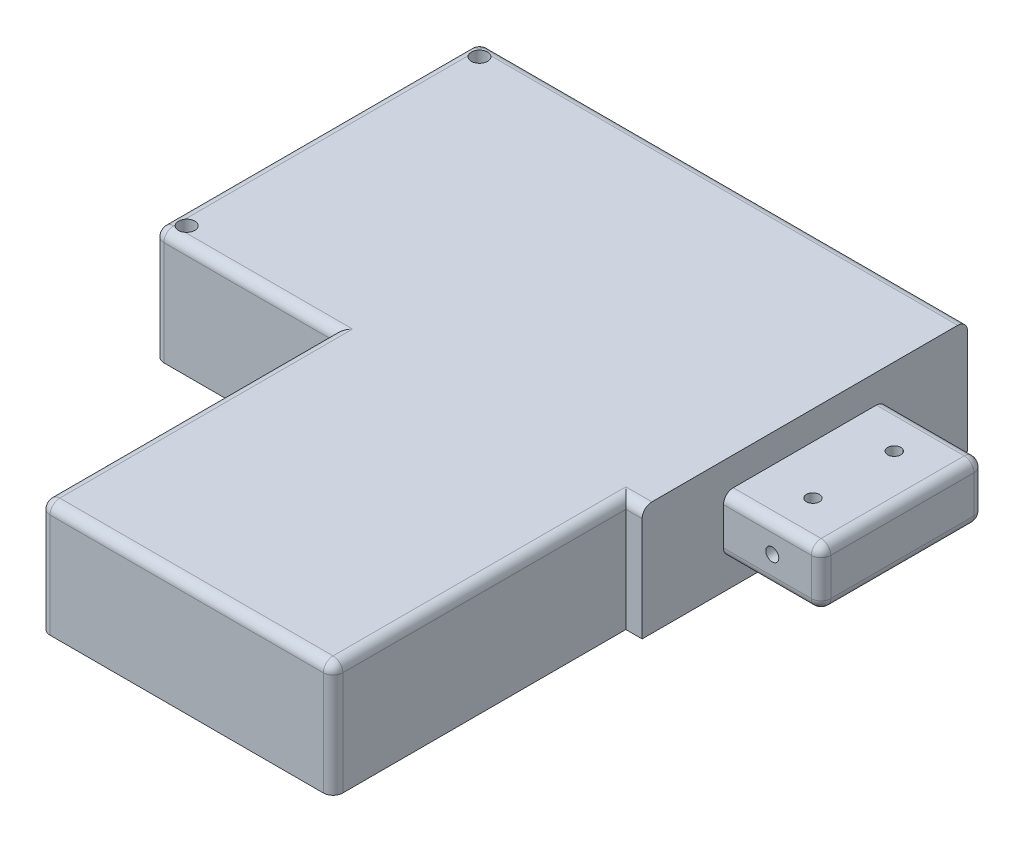
from build123d import *

# Parameters (mm, degrees)
SKETCH1_W           = 150
SKETCH1_H           = 100
BOSS_EXTRUDE1_DEPTH = 35
SKETCH2_R           = 2.5
CUT_EXTRUDE1_DEPTH  = 97.695398029
SKETCH3_W           = 90
SKETCH3_H           = 90
BOSS_EXTRUDE2_DEPTH = 35
CUT_EXTRUDE2_START  = -35
SKETCH4_R           = 18.5
CUT_EXTRUDE2_DEPTH  = 7
CUT_EXTRUDE3_START  = -35
SKETCH5_R           = 14
CUT_EXTRUDE3_DEPTH  = 25
SKETCH6_W           = 50
SKETCH6_H           = 17.5
BOSS_EXTRUDE3_DEPTH = 30
SKETCH7_R           = 2
CUT_EXTRUDE4_DEPTH  = 8
SKETCH8_R           = 2
CUT_EXTRUDE5_DEPTH  = 8
FILLET1_R           = 3


with BuildPart() as part:
    # Sketch1 → Boss-Extrude1 (new body)
    with BuildSketch(Plane(origin=(0, 0, 0), x_dir=(1, 0, 0), z_dir=(0, 1, 0))):
        Rectangle(SKETCH1_W, SKETCH1_H)
    extrude(amount=BOSS_EXTRUDE1_DEPTH)

    # Sketch2 → Cut-Extrude1 (cut, through all)
    with BuildSketch(Plane(origin=(0, 35, 0), x_dir=(1, 0, 0), z_dir=(0, 1, 0))):
        with Locations(Location((-70, 45, 0), (0, 0, 270))):
            Circle(SKETCH2_R)
        with Locations(Location((-70, -45, 0), (0, 0, 90))):
            Circle(SKETCH2_R)
    extrude(amount=-CUT_EXTRUDE1_DEPTH, mode=Mode.SUBTRACT)

    # Sketch3 → Boss-Extrude2 (add)
    with BuildSketch(Plane(origin=(0, 35, 0), x_dir=(1, 0, 0), z_dir=(0, 1, 0))):
        with Locations((25, -95)):
            Rectangle(SKETCH3_W, SKETCH3_H)
    extrude(amount=-BOSS_EXTRUDE2_DEPTH)

    # Sketch4 → Cut-Extrude2 (cut)
    with BuildSketch(Plane(origin=(0, 35, 0), x_dir=(1, 0, 0), z_dir=(0, 1, 0)).offset(CUT_EXTRUDE2_START)):
        with Locations(Location((25, -115, 0), (0, 0, 270))):
            Circle(SKETCH4_R)
        with Locations(Location((25, 0, 0), (0, 0, 270))):
            Circle(SKETCH4_R)
    extrude(amount=CUT_EXTRUDE2_DEPTH, mode=Mode.SUBTRACT)

    # Sketch5 → Cut-Extrude3 (cut)
    with BuildSketch(Plane(origin=(0, 35, 0), x_dir=(1, 0, 0), z_dir=(0, 1, 0)).offset(CUT_EXTRUDE3_START)):
        with Locations(Location((25, -115, 0), (0, 0, 270))):
            Circle(SKETCH5_R)
        with Locations(Location((25, 0, 0), (0, 0, 270))):
            Circle(SKETCH5_R)
    extrude(amount=CUT_EXTRUDE3_DEPTH, mode=Mode.SUBTRACT)

    # Sketch6 → Boss-Extrude3 (add)
    with BuildSketch(Plane(origin=(75, 0, 0), x_dir=(0, 0, -1), z_dir=(1, 0, 0))):
        with Locations((0, 17.5)):
            Rectangle(SKETCH6_W, SKETCH6_H)
    extrude(amount=BOSS_EXTRUDE3_DEPTH)

    # Sketch7 → Cut-Extrude4 (cut)
    with BuildSketch(Plane(origin=(0, 26.25, 0), x_dir=(1, 0, 0), z_dir=(0, 1, 0))):
        with Locations(Location((90, 12.5, 0), (0, 0, 270))):
            Circle(SKETCH7_R)
        with Locations(Location((90, -12.5, 0), (0, 0, 90))):
            Circle(SKETCH7_R)
    extrude(amount=-CUT_EXTRUDE4_DEPTH, mode=Mode.SUBTRACT)

    # Sketch8 → Cut-Extrude5 (cut)
    with BuildSketch(Plane(origin=(0, 0, -25), x_dir=(-1, 0, 0), z_dir=(0, 0, -1))):
        with Locations(Location((-90, 17.5, 0), (0, 0, 90))):
            Circle(SKETCH8_R)
    cut_extrude5 = extrude(amount=-CUT_EXTRUDE5_DEPTH, mode=Mode.SUBTRACT)

    # Mirror1: Cut-Extrude5 across plane
    add(cut_extrude5.mirror(Plane.XY), mode=Mode.SUBTRACT)

    # Fillet1
    # the kernel refuses this fillet: 3 mm, written as the material it takes off along each edge
    with BuildSketch(Plane(origin=(-72, 32, 47), x_dir=(0, 1, 0), z_dir=(-1, 0, 0))) as fillet1_piece_1_section:
        Polygon((0, 0), (FILLET1_R, 0), (FILLET1_R, -FILLET1_R), (0, -FILLET1_R), align=None)
    fillet1_piece_1 = extrude(amount=FILLET1_R, mode=Mode.PRIVATE)
    fillet1_piece_1 = fillet1_piece_1 - Plane(origin=(-72, 32, 47), x_dir=(0, -0.7071067811865475, -0.7071067811865475), z_dir=(-1, 0, 0)) * Sphere(FILLET1_R, mode=Mode.PRIVATE)
    add(fillet1_piece_1, mode=Mode.SUBTRACT)
    with BuildSketch(Plane(origin=(-72, 32, -47), x_dir=(-1, 0, 0), z_dir=(0, 0, -1))) as fillet1_piece_2_section:
        Polygon((0, 0), (FILLET1_R, 0), (FILLET1_R, FILLET1_R), (0, FILLET1_R), align=None)
    fillet1_piece_2 = extrude(amount=FILLET1_R, mode=Mode.PRIVATE)
    fillet1_piece_2 = fillet1_piece_2 - Plane(origin=(-72, 32, -47), x_dir=(0.7071067811865475, -0.7071067811865475, 0), z_dir=(0, 0, -1)) * Sphere(FILLET1_R, mode=Mode.PRIVATE)
    add(fillet1_piece_2, mode=Mode.SUBTRACT)
    with BuildSketch(Plane(origin=(67, 32, 137), x_dir=(1, 0, 0), z_dir=(0, 1, 0))) as fillet1_piece_3_section:
        Polygon((0, 0), (FILLET1_R, 0), (FILLET1_R, -FILLET1_R), (0, -FILLET1_R), align=None)
    fillet1_piece_3 = extrude(amount=FILLET1_R, mode=Mode.PRIVATE)
    fillet1_piece_3 = fillet1_piece_3 - Plane(origin=(67, 32, 137), x_dir=(-0.7071067811865475, 0, -0.7071067811865475), z_dir=(0, 1, 0)) * Sphere(FILLET1_R, mode=Mode.PRIVATE)
    add(fillet1_piece_3, mode=Mode.SUBTRACT)
    with BuildSketch(Plane(origin=(-17, 32, 137), x_dir=(0, 1, 0), z_dir=(-1, 0, 0))) as fillet1_piece_4_section:
        Polygon((0, 0), (FILLET1_R, 0), (FILLET1_R, -FILLET1_R), (0, -FILLET1_R), align=None)
    fillet1_piece_4 = extrude(amount=FILLET1_R, mode=Mode.PRIVATE)
    fillet1_piece_4 = fillet1_piece_4 - Plane(origin=(-17, 32, 137), x_dir=(0, -0.7071067811865475, -0.7071067811865475), z_dir=(-1, 0, 0)) * Sphere(FILLET1_R, mode=Mode.PRIVATE)
    add(fillet1_piece_4, mode=Mode.SUBTRACT)
    with BuildSketch(Plane(origin=(102, 11.75, -22), x_dir=(0, 0, -1), z_dir=(0, -1, 0))) as fillet1_piece_5_section:
        Polygon((0, 0), (FILLET1_R, 0), (FILLET1_R, FILLET1_R), (0, FILLET1_R), align=None)
    fillet1_piece_5 = extrude(amount=FILLET1_R, mode=Mode.PRIVATE)
    fillet1_piece_5 = fillet1_piece_5 - Plane(origin=(102, 11.75, -22), x_dir=(-0.7071067811865475, 0, 0.7071067811865475), z_dir=(0, -1, 0)) * Sphere(FILLET1_R, mode=Mode.PRIVATE)
    add(fillet1_piece_5, mode=Mode.SUBTRACT)
    with BuildSketch(Plane(origin=(102, 23.25, -22), x_dir=(0, 1, 0), z_dir=(0, 0, -1))) as fillet1_piece_6_section:
        Polygon((0, 0), (FILLET1_R, 0), (FILLET1_R, FILLET1_R), (0, FILLET1_R), align=None)
    fillet1_piece_6 = extrude(amount=FILLET1_R, mode=Mode.PRIVATE)
    fillet1_piece_6 = fillet1_piece_6 - Plane(origin=(102, 23.25, -22), x_dir=(-0.7071067811865475, -0.7071067811865475, 0), z_dir=(0, 0, -1)) * Sphere(FILLET1_R, mode=Mode.PRIVATE)
    add(fillet1_piece_6, mode=Mode.SUBTRACT)
    with BuildSketch(Plane(origin=(102, 23.25, 22), x_dir=(1, 0, 0), z_dir=(0, 1, 0))) as fillet1_piece_7_section:
        Polygon((0, 0), (FILLET1_R, 0), (FILLET1_R, -FILLET1_R), (0, -FILLET1_R), align=None)
    fillet1_piece_7 = extrude(amount=FILLET1_R, mode=Mode.PRIVATE)
    fillet1_piece_7 = fillet1_piece_7 - Plane(origin=(102, 23.25, 22), x_dir=(-0.7071067811865475, 0, -0.7071067811865475), z_dir=(0, 1, 0)) * Sphere(FILLET1_R, mode=Mode.PRIVATE)
    add(fillet1_piece_7, mode=Mode.SUBTRACT)
    with BuildSketch(Plane(origin=(102, 11.75, 22), x_dir=(1, 0, 0), z_dir=(0, -1, 0))) as fillet1_piece_8_section:
        Polygon((0, 0), (FILLET1_R, 0), (FILLET1_R, FILLET1_R), (0, FILLET1_R), align=None)
    fillet1_piece_8 = extrude(amount=FILLET1_R, mode=Mode.PRIVATE)
    fillet1_piece_8 = fillet1_piece_8 - Plane(origin=(102, 11.75, 22), x_dir=(-0.7071067811865475, 0, -0.7071067811865475), z_dir=(0, -1, 0)) * Sphere(FILLET1_R, mode=Mode.PRIVATE)
    add(fillet1_piece_8, mode=Mode.SUBTRACT)
    with BuildSketch(Plane(origin=(-75, 35, 47), x_dir=(0, -1, 0), z_dir=(0, 0, -1))) as fillet1_piece_9:
        with BuildLine():
            CenterArc((FILLET1_R, -FILLET1_R), FILLET1_R, 90, 90)
            Line((0, -FILLET1_R), (0, 0))
            Line((0, 0), (FILLET1_R, 0))
        make_face()
    extrude(amount=94, mode=Mode.SUBTRACT)
    with BuildSketch(Plane(origin=(-20, 35, 50), x_dir=(0, 0, -1), z_dir=(-1, 0, 0))) as fillet1_piece_10:
        with BuildLine():
            CenterArc((FILLET1_R, FILLET1_R), FILLET1_R, 180, 90)
            Line((0, FILLET1_R), (0, 0))
            Line((0, 0), (FILLET1_R, 0))
        make_face()
    extrude(amount=52, mode=Mode.SUBTRACT)
    with BuildSketch(Plane(origin=(82.5, 35, 50), x_dir=(0, 0, -1), z_dir=(-1, 0, 0))) as fillet1_piece_11:
        with BuildLine():
            CenterArc((FILLET1_R, FILLET1_R), FILLET1_R, 180, 90)
            Line((0, FILLET1_R), (0, 0))
            Line((0, 0), (FILLET1_R, 0))
        make_face()
    extrude(amount=12.5, mode=Mode.SUBTRACT)
    with BuildSketch(Plane(origin=(70, 32, 140), x_dir=(0, 0, -1), z_dir=(0, -1, 0)), Plane(origin=(-75, -7.5, 50), x_dir=(0, 0, -1), z_dir=(0, 1, 0)), Plane(origin=(-75, -7.5, -50), x_dir=(1, 0, 0), z_dir=(0, 1, 0))) as fillet1_piece_12:
        with BuildLine():
            CenterArc((FILLET1_R, -FILLET1_R), FILLET1_R, 90, 90)
            Line((0, -FILLET1_R), (0, 0))
            Line((0, 0), (FILLET1_R, 0))
        make_face()
    extrude(amount=39.5, mode=Mode.SUBTRACT)
    with BuildSketch(Plane(origin=(-20, 32, 140), x_dir=(0, 0, -1), z_dir=(0, -1, 0))) as fillet1_piece_13:
        with BuildLine():
            CenterArc((FILLET1_R, FILLET1_R), FILLET1_R, 180, 90)
            Line((0, FILLET1_R), (0, 0))
            Line((0, 0), (FILLET1_R, 0))
        make_face()
    extrude(amount=39.5, mode=Mode.SUBTRACT)
    with BuildSketch(Plane(origin=(70, 35, 137), x_dir=(-1, 0, 0), z_dir=(0, 0, -1)), Plane(origin=(-20, 35, 50), x_dir=(1, 0, 0), z_dir=(0, 0, 1))) as fillet1_piece_14:
        with BuildLine():
            CenterArc((FILLET1_R, -FILLET1_R), FILLET1_R, 90, 90)
            Line((0, -FILLET1_R), (0, 0))
            Line((0, 0), (FILLET1_R, 0))
        make_face()
    extrude(amount=87, mode=Mode.SUBTRACT)
    with BuildSketch(Plane(origin=(-17, 35, 140), x_dir=(0, 0, -1), z_dir=(1, 0, 0))) as fillet1_piece_15:
        with BuildLine():
            CenterArc((FILLET1_R, -FILLET1_R), FILLET1_R, 90, 90)
            Line((0, -FILLET1_R), (0, 0))
            Line((0, 0), (FILLET1_R, 0))
        make_face()
    extrude(amount=84, mode=Mode.SUBTRACT)
    with BuildSketch(Plane(origin=(75, 8.75, -25), x_dir=(0, 0, 1), z_dir=(1, 0, 0)), Plane(origin=(75, 26.25, -25), x_dir=(0, -1, 0), z_dir=(1, 0, 0)), Plane(origin=(75, 8.75, 25), x_dir=(0, 1, 0), z_dir=(1, 0, 0))) as fillet1_piece_16:
        with BuildLine():
            CenterArc((FILLET1_R, -FILLET1_R), FILLET1_R, 90, 90)
            Line((0, -FILLET1_R), (0, 0))
            Line((0, 0), (FILLET1_R, 0))
        make_face()
    extrude(amount=27, mode=Mode.SUBTRACT)
    with BuildSketch(Plane(origin=(75, 26.25, 25), x_dir=(0, -1, 0), z_dir=(1, 0, 0))) as fillet1_piece_17:
        with BuildLine():
            CenterArc((FILLET1_R, FILLET1_R), FILLET1_R, 180, 90)
            Line((0, FILLET1_R), (0, 0))
            Line((0, 0), (FILLET1_R, 0))
        make_face()
    extrude(amount=27, mode=Mode.SUBTRACT)
    with BuildSketch(Plane(origin=(105, 23.25, -25), x_dir=(-1, 0, 0), z_dir=(0, -1, 0)), Plane(origin=(105, 11.75, 25), x_dir=(-1, 0, 0), z_dir=(0, 1, 0))) as fillet1_piece_18:
        with BuildLine():
            CenterArc((FILLET1_R, -FILLET1_R), FILLET1_R, 90, 90)
            Line((0, -FILLET1_R), (0, 0))
            Line((0, 0), (FILLET1_R, 0))
        make_face()
    extrude(amount=11.5, mode=Mode.SUBTRACT)
    with BuildSketch(Plane(origin=(105, 26.25, 22), x_dir=(-1, 0, 0), z_dir=(0, 0, -1)), Plane(origin=(105, 8.75, -22), x_dir=(-1, 0, 0), z_dir=(0, 0, 1))) as fillet1_piece_19:
        with BuildLine():
            CenterArc((FILLET1_R, -FILLET1_R), FILLET1_R, 90, 90)
            Line((0, -FILLET1_R), (0, 0))
            Line((0, 0), (FILLET1_R, 0))
        make_face()
    extrude(amount=44, mode=Mode.SUBTRACT)
    with BuildSketch(Plane(origin=(-72, 35, -50), x_dir=(0, -1, 0), z_dir=(1, 0, 0))) as fillet1_piece_20:
        with BuildLine():
            CenterArc((FILLET1_R, -FILLET1_R), FILLET1_R, 90, 90)
            Line((0, -FILLET1_R), (0, 0))
            Line((0, 0), (FILLET1_R, 0))
        make_face()
    extrude(amount=154.5, mode=Mode.SUBTRACT)
    with BuildSketch(Plane(origin=(-20, 35, 42.5), x_dir=(1, 0, 0), z_dir=(0, 0, 1))) as fillet1_piece_21a_section:
        with BuildLine():
            CenterArc((FILLET1_R, -FILLET1_R), FILLET1_R, 90, 90)
            Line((0, -FILLET1_R), (0, 0))
            Line((0, 0), (FILLET1_R, 0))
        make_face()
    fillet1_piece_21a = extrude(amount=94.5, mode=Mode.PRIVATE)
    fillet1_piece_21a = split(fillet1_piece_21a, bisect_by=Plane(origin=(-19.320814657, 34.320814657, 50), z_dir=(0, 0, -1)), keep=Keep.TOP, mode=Mode.PRIVATE)
    with BuildSketch(Plane(origin=(-12.5, 35, 50), x_dir=(0, 0, -1), z_dir=(-1, 0, 0))) as fillet1_piece_21b_section:
        with BuildLine():
            CenterArc((FILLET1_R, FILLET1_R), FILLET1_R, 180, 90)
            Line((0, FILLET1_R), (0, 0))
            Line((0, 0), (FILLET1_R, 0))
        make_face()
    fillet1_piece_21b = extrude(amount=59.5, mode=Mode.PRIVATE)
    fillet1_piece_21b = split(fillet1_piece_21b, bisect_by=Plane(origin=(-20, 34.320814657, 49.320814657), z_dir=(1, 0, 0)), keep=Keep.TOP, mode=Mode.PRIVATE)
    fillet1_piece_21 = fillet1_piece_21a & fillet1_piece_21b
    add(fillet1_piece_21, mode=Mode.SUBTRACT)
    with BuildSketch(Plane(origin=(82.5, 35, 50), x_dir=(0, 0, -1), z_dir=(-1, 0, 0))) as fillet1_piece_22a_section:
        with BuildLine():
            CenterArc((FILLET1_R, FILLET1_R), FILLET1_R, 180, 90)
            Line((0, FILLET1_R), (0, 0))
            Line((0, 0), (FILLET1_R, 0))
        make_face()
    fillet1_piece_22a = extrude(amount=20, mode=Mode.PRIVATE)
    fillet1_piece_22a = split(fillet1_piece_22a, bisect_by=Plane(origin=(70, 34.320814657, 49.320814657), z_dir=(-1, 0, 0)), keep=Keep.TOP, mode=Mode.PRIVATE)
    with BuildSketch(Plane(origin=(70, 35, 137), x_dir=(-1, 0, 0), z_dir=(0, 0, -1))) as fillet1_piece_22b_section:
        with BuildLine():
            CenterArc((FILLET1_R, -FILLET1_R), FILLET1_R, 90, 90)
            Line((0, -FILLET1_R), (0, 0))
            Line((0, 0), (FILLET1_R, 0))
        make_face()
    fillet1_piece_22b = extrude(amount=94.5, mode=Mode.PRIVATE)
    fillet1_piece_22b = split(fillet1_piece_22b, bisect_by=Plane(origin=(69.320814657, 34.320814657, 50), z_dir=(0, 0, -1)), keep=Keep.TOP, mode=Mode.PRIVATE)
    fillet1_piece_22 = fillet1_piece_22a & fillet1_piece_22b
    add(fillet1_piece_22, mode=Mode.SUBTRACT)


solid = part.part
